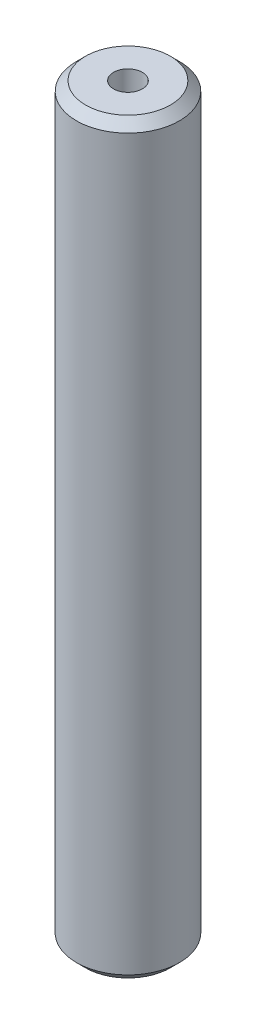
from build123d import *

# Parameters (mm, degrees)
SKETCH1_R           = 10
BOSS_EXTRUDE1_DEPTH = 145.123616746
SKETCH2_R           = 2.796233423
CUT_EXTRUDE1_DEPTH  = 146.811056293
CHAMFER1_SIZE       = 1.769879386


with BuildPart() as part:
    # Sketch1 → Boss-Extrude1 (new body)
    with BuildSketch(Plane(origin=(0, 0, 0), x_dir=(1, 0, 0), z_dir=(0, 1, 0))):
        Circle(SKETCH1_R)
    extrude(amount=BOSS_EXTRUDE1_DEPTH)

    # Sketch2 → Cut-Extrude1 (cut, through all)
    with BuildSketch(Plane(origin=(0, 0, 0), x_dir=(1, 0, 0), z_dir=(0, 1, 0))):
        Circle(SKETCH2_R)
    extrude(amount=CUT_EXTRUDE1_DEPTH, mode=Mode.SUBTRACT)

    # Chamfer1
    chamfer1_edges = [part.edges().sort_by_distance(p)[0] for p in [
        (-10, 145.123616746, 0),
        (-10, 0, 0),
    ]]
    chamfer(chamfer1_edges, length=CHAMFER1_SIZE)


solid = part.part
